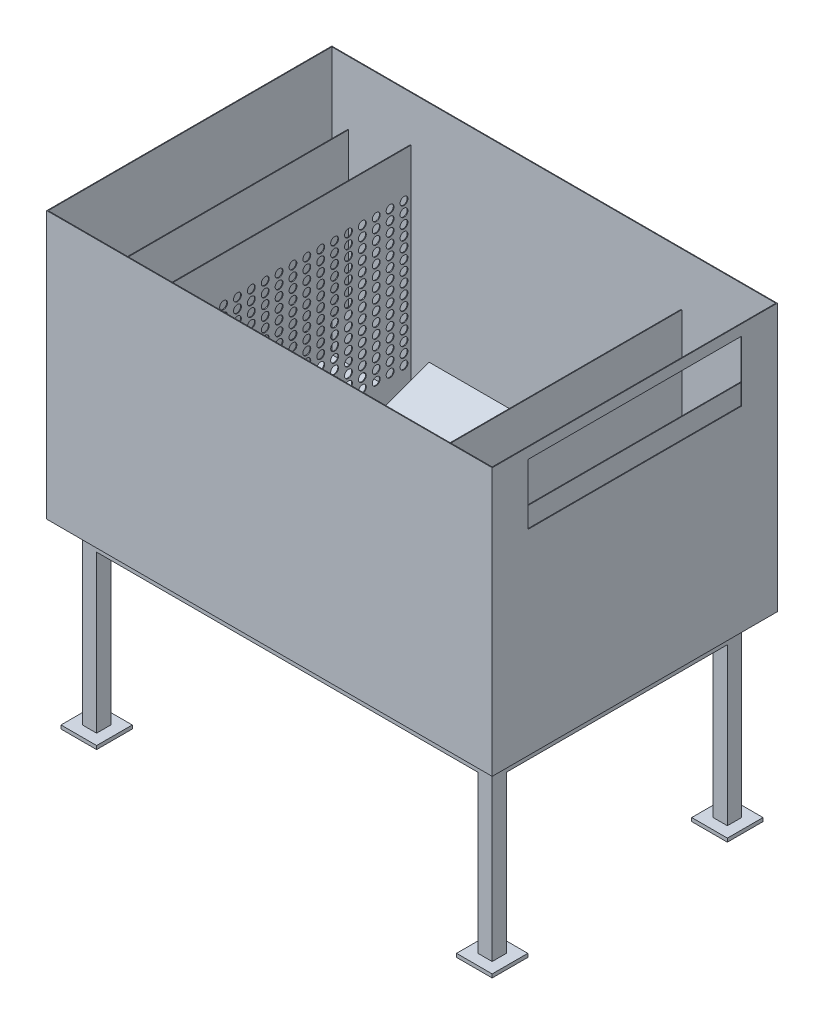
from build123d import *

# Parameters (mm, degrees)
MASTER_FOOTPRINT_W             = 1250
MASTER_FOOTPRINT_H             = 800
BATH_BASE_PLATE_DEPTH          = 750
BATH_SHELL_2MM_T               = -2
SKETCH_1_R                     = 50
INLET_D100_OPENING_DEPTH       = 10
INLET_IMPACT_BAFFLE_START      = 125
SKETCH_2_W                     = 640
SKETCH_2_H                     = 430
INLET_IMPACT_BAFFLE_DEPTH      = 2
DISTRIBUTOR_D22_START          = 250
SKETCH_3_W                     = 740
SKETCH_3_H                     = 648
SKETCH_3_R                     = 11
DISTRIBUTOR_D22_DEPTH          = 2
OUTLET_SUBMERGED_BAFFLE_START  = 1030
SKETCH_4_W                     = 700
SKETCH_4_H                     = 330
OUTLET_SUBMERGED_BAFFLE_DEPTH  = 2
OVERFLOW_WEIR_Z550_START       = 1190
SKETCH_5_W                     = 790
SKETCH_5_H                     = 548
OVERFLOW_WEIR_Z550_DEPTH       = 2
OUTLET_WEIR_SLOT_W600_START    = 1245
SKETCH_6_W                     = 600
SKETCH_6_H                     = 170
OUTLET_WEIR_SLOT_W600_DEPTH    = 10
SLOPED_SEDIMENT_FLOOR_START    = 275
SLOPED_SEDIMENT_FLOOR_DEPTH    = 725
SKETCH_8_W                     = 40
SKETCH_8_H                     = 40
FRAME_LEGS_40X40_H500_DEPTH    = 500
FRAME_LONGITUDINAL_RAILS_START = -20
SKETCH_9_W                     = 1150
SKETCH_9_H                     = 40
FRAME_LONGITUDINAL_RAILS_DEPTH = 40
FRAME_TRANSVERSE_RAILS_START   = -20
SKETCH_10_W                    = 40
SKETCH_10_H                    = 620
FRAME_TRANSVERSE_RAILS_DEPTH   = 40
FRAME_FOOT_PADS_100X100_START  = -500
SKETCH_11_W                    = 100
SKETCH_11_H                    = 100
FRAME_FOOT_PADS_100X100_DEPTH  = 10


with BuildPart() as part:
    # MASTER_FOOTPRINT → BATH_BASE_PLATE (new body)
    with BuildSketch(Plane(origin=(0, 0, 0), x_dir=(1, 0, 0), z_dir=(0, 1, 0))):
        with Locations((625, 400)):
            Rectangle(MASTER_FOOTPRINT_W, MASTER_FOOTPRINT_H)
    extrude(amount=BATH_BASE_PLATE_DEPTH)

    # BATH_SHELL_2MM
    bath_shell_2mm_openings = [part.faces().sort_by_distance(p)[0] for p in [
        (625, 750, -400),
    ]]
    offset(amount=BATH_SHELL_2MM_T, openings=bath_shell_2mm_openings, kind=Kind.INTERSECTION)

    # Эскиз1 → INLET_D100_OPENING (cut)
    with BuildSketch(Plane(origin=(0, 0, 0), x_dir=(0, 0, -1), z_dir=(1, 0, 0))):
        with Locations((400, 420)):
            Circle(SKETCH_1_R)
    extrude(amount=INLET_D100_OPENING_DEPTH, mode=Mode.SUBTRACT)

    # Эскиз6 → OUTLET_WEIR_SLOT_W600 (cut)
    with BuildSketch(Plane(origin=(0, 0, 0), x_dir=(0, 0, -1), z_dir=(1, 0, 0)).offset(OUTLET_WEIR_SLOT_W600_START)):
        with Locations((400, 635)):
            Rectangle(SKETCH_6_W, SKETCH_6_H)
    extrude(amount=OUTLET_WEIR_SLOT_W600_DEPTH, mode=Mode.SUBTRACT)

    # Эскиз7 → SLOPED_SEDIMENT_FLOOR (add)
    with BuildSketch(Plane(origin=(0, 0, 0), x_dir=(0, 0, -1), z_dir=(1, 0, 0)).offset(SLOPED_SEDIMENT_FLOOR_START)):
        Polygon((2, -1), (2, 120), (330, -1), align=None)
        Polygon((798, -1), (798, 120), (470, -1), align=None)
    extrude(amount=SLOPED_SEDIMENT_FLOOR_DEPTH)

    # Эскиз8 → FRAME_LEGS_40X40_H500 (add)
    with BuildSketch(Plane(origin=(0, 0, 0), x_dir=(1, 0, 0), z_dir=(0, 1, 0))):
        with Locations((70, 70)):
            Rectangle(SKETCH_8_W, SKETCH_8_H)
        with Locations((70, 730)):
            Rectangle(SKETCH_8_W, SKETCH_8_H)
        with Locations((1180, 70)):
            Rectangle(SKETCH_8_W, SKETCH_8_H)
        with Locations((1180, 730)):
            Rectangle(SKETCH_8_W, SKETCH_8_H)
    extrude(amount=-FRAME_LEGS_40X40_H500_DEPTH)

    # Эскиз9 → FRAME_LONGITUDINAL_RAILS (add)
    with BuildSketch(Plane(origin=(0, 0, 0), x_dir=(1, 0, 0), z_dir=(0, 1, 0)).offset(FRAME_LONGITUDINAL_RAILS_START)):
        with Locations((625, 70)):
            Rectangle(SKETCH_9_W, SKETCH_9_H)
        with Locations((625, 730)):
            Rectangle(SKETCH_9_W, SKETCH_9_H)
    extrude(amount=-FRAME_LONGITUDINAL_RAILS_DEPTH)

    # Эскиз10 → FRAME_TRANSVERSE_RAILS (add)
    with BuildSketch(Plane(origin=(0, 0, 0), x_dir=(1, 0, 0), z_dir=(0, 1, 0)).offset(FRAME_TRANSVERSE_RAILS_START)):
        with Locations((70, 400)):
            Rectangle(SKETCH_10_W, SKETCH_10_H)
        with Locations((1180, 400)):
            Rectangle(SKETCH_10_W, SKETCH_10_H)
    extrude(amount=-FRAME_TRANSVERSE_RAILS_DEPTH)

    # Эскиз11 → FRAME_FOOT_PADS_100X100 (add)
    with BuildSketch(Plane(origin=(0, 0, 0), x_dir=(1, 0, 0), z_dir=(0, 1, 0)).offset(FRAME_FOOT_PADS_100X100_START)):
        with Locations((70, 70)):
            Rectangle(SKETCH_11_W, SKETCH_11_H)
        with Locations((70, 730)):
            Rectangle(SKETCH_11_W, SKETCH_11_H)
        with Locations((1180, 70)):
            Rectangle(SKETCH_11_W, SKETCH_11_H)
        with Locations((1180, 730)):
            Rectangle(SKETCH_11_W, SKETCH_11_H)
    extrude(amount=-FRAME_FOOT_PADS_100X100_DEPTH)


with BuildPart() as body_2:
    # Эскиз2 → INLET_IMPACT_BAFFLE (new body)
    with BuildSketch(Plane(origin=(0, 0, 0), x_dir=(0, 0, -1), z_dir=(1, 0, 0)).offset(INLET_IMPACT_BAFFLE_START)):
        with Locations((400, 435)):
            Rectangle(SKETCH_2_W, SKETCH_2_H)
    extrude(amount=INLET_IMPACT_BAFFLE_DEPTH)


with BuildPart() as body_3:
    # Эскиз3 → DISTRIBUTOR_D22 (new body)
    with BuildSketch(Plane(origin=(0, 0, 0), x_dir=(0, 0, -1), z_dir=(1, 0, 0)).offset(DISTRIBUTOR_D22_START)):
        with Locations((400, 326)):
            Rectangle(SKETCH_3_W, SKETCH_3_H)
        with Locations((49.473684211, 125)):
            Circle(SKETCH_3_R, mode=Mode.SUBTRACT)
        with Locations((49.473684211, 153.5)):
            Circle(SKETCH_3_R, mode=Mode.SUBTRACT)
        with Locations((49.473684211, 182)):
            Circle(SKETCH_3_R, mode=Mode.SUBTRACT)
        with Locations((49.473684211, 210.5)):
            Circle(SKETCH_3_R, mode=Mode.SUBTRACT)
        with Locations((49.473684211, 239)):
            Circle(SKETCH_3_R, mode=Mode.SUBTRACT)
        with Locations((49.473684211, 267.5)):
            Circle(SKETCH_3_R, mode=Mode.SUBTRACT)
        with Locations((49.473684211, 296)):
            Circle(SKETCH_3_R, mode=Mode.SUBTRACT)
        with Locations((49.473684211, 324.5)):
            Circle(SKETCH_3_R, mode=Mode.SUBTRACT)
        with Locations((49.473684211, 353)):
            Circle(SKETCH_3_R, mode=Mode.SUBTRACT)
        with Locations((49.473684211, 381.5)):
            Circle(SKETCH_3_R, mode=Mode.SUBTRACT)
        with Locations((49.473684211, 410)):
            Circle(SKETCH_3_R, mode=Mode.SUBTRACT)
        with Locations((49.473684211, 438.5)):
            Circle(SKETCH_3_R, mode=Mode.SUBTRACT)
        with Locations((49.473684211, 467)):
            Circle(SKETCH_3_R, mode=Mode.SUBTRACT)
        with Locations((49.473684211, 495.5)):
            Circle(SKETCH_3_R, mode=Mode.SUBTRACT)
        with Locations((49.473684211, 524)):
            Circle(SKETCH_3_R, mode=Mode.SUBTRACT)
        with Locations((88.421052632, 125)):
            Circle(SKETCH_3_R, mode=Mode.SUBTRACT)
        with Locations((88.421052632, 153.5)):
            Circle(SKETCH_3_R, mode=Mode.SUBTRACT)
        with Locations((88.421052632, 182)):
            Circle(SKETCH_3_R, mode=Mode.SUBTRACT)
        with Locations((88.421052632, 210.5)):
            Circle(SKETCH_3_R, mode=Mode.SUBTRACT)
        with Locations((88.421052632, 239)):
            Circle(SKETCH_3_R, mode=Mode.SUBTRACT)
        with Locations((88.421052632, 267.5)):
            Circle(SKETCH_3_R, mode=Mode.SUBTRACT)
        with Locations((88.421052632, 296)):
            Circle(SKETCH_3_R, mode=Mode.SUBTRACT)
        with Locations((88.421052632, 324.5)):
            Circle(SKETCH_3_R, mode=Mode.SUBTRACT)
        with Locations((88.421052632, 353)):
            Circle(SKETCH_3_R, mode=Mode.SUBTRACT)
        with Locations((88.421052632, 381.5)):
            Circle(SKETCH_3_R, mode=Mode.SUBTRACT)
        with Locations((88.421052632, 410)):
            Circle(SKETCH_3_R, mode=Mode.SUBTRACT)
        with Locations((88.421052632, 438.5)):
            Circle(SKETCH_3_R, mode=Mode.SUBTRACT)
        with Locations((88.421052632, 467)):
            Circle(SKETCH_3_R, mode=Mode.SUBTRACT)
        with Locations((88.421052632, 495.5)):
            Circle(SKETCH_3_R, mode=Mode.SUBTRACT)
        with Locations((88.421052632, 524)):
            Circle(SKETCH_3_R, mode=Mode.SUBTRACT)
        with Locations((127.368421053, 125)):
            Circle(SKETCH_3_R, mode=Mode.SUBTRACT)
        with Locations((127.368421053, 153.5)):
            Circle(SKETCH_3_R, mode=Mode.SUBTRACT)
        with Locations((127.368421053, 182)):
            Circle(SKETCH_3_R, mode=Mode.SUBTRACT)
        with Locations((127.368421053, 210.5)):
            Circle(SKETCH_3_R, mode=Mode.SUBTRACT)
        with Locations((127.368421053, 239)):
            Circle(SKETCH_3_R, mode=Mode.SUBTRACT)
        with Locations((127.368421053, 267.5)):
            Circle(SKETCH_3_R, mode=Mode.SUBTRACT)
        with Locations((127.368421053, 296)):
            Circle(SKETCH_3_R, mode=Mode.SUBTRACT)
        with Locations((127.368421053, 324.5)):
            Circle(SKETCH_3_R, mode=Mode.SUBTRACT)
        with Locations((127.368421053, 353)):
            Circle(SKETCH_3_R, mode=Mode.SUBTRACT)
        with Locations((127.368421053, 381.5)):
            Circle(SKETCH_3_R, mode=Mode.SUBTRACT)
        with Locations((127.368421053, 410)):
            Circle(SKETCH_3_R, mode=Mode.SUBTRACT)
        with Locations((127.368421053, 438.5)):
            Circle(SKETCH_3_R, mode=Mode.SUBTRACT)
        with Locations((127.368421053, 467)):
            Circle(SKETCH_3_R, mode=Mode.SUBTRACT)
        with Locations((127.368421053, 495.5)):
            Circle(SKETCH_3_R, mode=Mode.SUBTRACT)
        with Locations((127.368421053, 524)):
            Circle(SKETCH_3_R, mode=Mode.SUBTRACT)
        with Locations((166.315789474, 125)):
            Circle(SKETCH_3_R, mode=Mode.SUBTRACT)
        with Locations((166.315789474, 153.5)):
            Circle(SKETCH_3_R, mode=Mode.SUBTRACT)
        with Locations((166.315789474, 182)):
            Circle(SKETCH_3_R, mode=Mode.SUBTRACT)
        with Locations((166.315789474, 210.5)):
            Circle(SKETCH_3_R, mode=Mode.SUBTRACT)
        with Locations((166.315789474, 239)):
            Circle(SKETCH_3_R, mode=Mode.SUBTRACT)
        with Locations((166.315789474, 267.5)):
            Circle(SKETCH_3_R, mode=Mode.SUBTRACT)
        with Locations((166.315789474, 296)):
            Circle(SKETCH_3_R, mode=Mode.SUBTRACT)
        with Locations((166.315789474, 324.5)):
            Circle(SKETCH_3_R, mode=Mode.SUBTRACT)
        with Locations((166.315789474, 353)):
            Circle(SKETCH_3_R, mode=Mode.SUBTRACT)
        with Locations((166.315789474, 381.5)):
            Circle(SKETCH_3_R, mode=Mode.SUBTRACT)
        with Locations((166.315789474, 410)):
            Circle(SKETCH_3_R, mode=Mode.SUBTRACT)
        with Locations((166.315789474, 438.5)):
            Circle(SKETCH_3_R, mode=Mode.SUBTRACT)
        with Locations((166.315789474, 467)):
            Circle(SKETCH_3_R, mode=Mode.SUBTRACT)
        with Locations((166.315789474, 495.5)):
            Circle(SKETCH_3_R, mode=Mode.SUBTRACT)
        with Locations((166.315789474, 524)):
            Circle(SKETCH_3_R, mode=Mode.SUBTRACT)
        with Locations((205.263157895, 125)):
            Circle(SKETCH_3_R, mode=Mode.SUBTRACT)
        with Locations((205.263157895, 153.5)):
            Circle(SKETCH_3_R, mode=Mode.SUBTRACT)
        with Locations((205.263157895, 182)):
            Circle(SKETCH_3_R, mode=Mode.SUBTRACT)
        with Locations((205.263157895, 210.5)):
            Circle(SKETCH_3_R, mode=Mode.SUBTRACT)
        with Locations((205.263157895, 239)):
            Circle(SKETCH_3_R, mode=Mode.SUBTRACT)
        with Locations((205.263157895, 267.5)):
            Circle(SKETCH_3_R, mode=Mode.SUBTRACT)
        with Locations((205.263157895, 296)):
            Circle(SKETCH_3_R, mode=Mode.SUBTRACT)
        with Locations((205.263157895, 324.5)):
            Circle(SKETCH_3_R, mode=Mode.SUBTRACT)
        with Locations((205.263157895, 353)):
            Circle(SKETCH_3_R, mode=Mode.SUBTRACT)
        with Locations((205.263157895, 381.5)):
            Circle(SKETCH_3_R, mode=Mode.SUBTRACT)
        with Locations((205.263157895, 410)):
            Circle(SKETCH_3_R, mode=Mode.SUBTRACT)
        with Locations((205.263157895, 438.5)):
            Circle(SKETCH_3_R, mode=Mode.SUBTRACT)
        with Locations((205.263157895, 467)):
            Circle(SKETCH_3_R, mode=Mode.SUBTRACT)
        with Locations((205.263157895, 495.5)):
            Circle(SKETCH_3_R, mode=Mode.SUBTRACT)
        with Locations((205.263157895, 524)):
            Circle(SKETCH_3_R, mode=Mode.SUBTRACT)
        with Locations((244.210526316, 125)):
            Circle(SKETCH_3_R, mode=Mode.SUBTRACT)
        with Locations((244.210526316, 153.5)):
            Circle(SKETCH_3_R, mode=Mode.SUBTRACT)
        with Locations((244.210526316, 182)):
            Circle(SKETCH_3_R, mode=Mode.SUBTRACT)
        with Locations((244.210526316, 210.5)):
            Circle(SKETCH_3_R, mode=Mode.SUBTRACT)
        with Locations((244.210526316, 239)):
            Circle(SKETCH_3_R, mode=Mode.SUBTRACT)
        with Locations((244.210526316, 267.5)):
            Circle(SKETCH_3_R, mode=Mode.SUBTRACT)
        with Locations((244.210526316, 296)):
            Circle(SKETCH_3_R, mode=Mode.SUBTRACT)
        with Locations((244.210526316, 324.5)):
            Circle(SKETCH_3_R, mode=Mode.SUBTRACT)
        with Locations((244.210526316, 353)):
            Circle(SKETCH_3_R, mode=Mode.SUBTRACT)
        with Locations((244.210526316, 381.5)):
            Circle(SKETCH_3_R, mode=Mode.SUBTRACT)
        with Locations((244.210526316, 410)):
            Circle(SKETCH_3_R, mode=Mode.SUBTRACT)
        with Locations((244.210526316, 438.5)):
            Circle(SKETCH_3_R, mode=Mode.SUBTRACT)
        with Locations((244.210526316, 467)):
            Circle(SKETCH_3_R, mode=Mode.SUBTRACT)
        with Locations((244.210526316, 495.5)):
            Circle(SKETCH_3_R, mode=Mode.SUBTRACT)
        with Locations((244.210526316, 524)):
            Circle(SKETCH_3_R, mode=Mode.SUBTRACT)
        with Locations((283.157894737, 125)):
            Circle(SKETCH_3_R, mode=Mode.SUBTRACT)
        with Locations((283.157894737, 153.5)):
            Circle(SKETCH_3_R, mode=Mode.SUBTRACT)
        with Locations((283.157894737, 182)):
            Circle(SKETCH_3_R, mode=Mode.SUBTRACT)
        with Locations((283.157894737, 210.5)):
            Circle(SKETCH_3_R, mode=Mode.SUBTRACT)
        with Locations((283.157894737, 239)):
            Circle(SKETCH_3_R, mode=Mode.SUBTRACT)
        with Locations((283.157894737, 267.5)):
            Circle(SKETCH_3_R, mode=Mode.SUBTRACT)
        with Locations((283.157894737, 296)):
            Circle(SKETCH_3_R, mode=Mode.SUBTRACT)
        with Locations((283.157894737, 324.5)):
            Circle(SKETCH_3_R, mode=Mode.SUBTRACT)
        with Locations((283.157894737, 353)):
            Circle(SKETCH_3_R, mode=Mode.SUBTRACT)
        with Locations((283.157894737, 381.5)):
            Circle(SKETCH_3_R, mode=Mode.SUBTRACT)
        with Locations((283.157894737, 410)):
            Circle(SKETCH_3_R, mode=Mode.SUBTRACT)
        with Locations((283.157894737, 438.5)):
            Circle(SKETCH_3_R, mode=Mode.SUBTRACT)
        with Locations((283.157894737, 467)):
            Circle(SKETCH_3_R, mode=Mode.SUBTRACT)
        with Locations((283.157894737, 495.5)):
            Circle(SKETCH_3_R, mode=Mode.SUBTRACT)
        with Locations((283.157894737, 524)):
            Circle(SKETCH_3_R, mode=Mode.SUBTRACT)
        with Locations((322.105263158, 125)):
            Circle(SKETCH_3_R, mode=Mode.SUBTRACT)
        with Locations((322.105263158, 153.5)):
            Circle(SKETCH_3_R, mode=Mode.SUBTRACT)
        with Locations((322.105263158, 182)):
            Circle(SKETCH_3_R, mode=Mode.SUBTRACT)
        with Locations((322.105263158, 210.5)):
            Circle(SKETCH_3_R, mode=Mode.SUBTRACT)
        with Locations((322.105263158, 239)):
            Circle(SKETCH_3_R, mode=Mode.SUBTRACT)
        with Locations((322.105263158, 267.5)):
            Circle(SKETCH_3_R, mode=Mode.SUBTRACT)
        with Locations((322.105263158, 296)):
            Circle(SKETCH_3_R, mode=Mode.SUBTRACT)
        with Locations((322.105263158, 324.5)):
            Circle(SKETCH_3_R, mode=Mode.SUBTRACT)
        with Locations((322.105263158, 353)):
            Circle(SKETCH_3_R, mode=Mode.SUBTRACT)
        with Locations((322.105263158, 381.5)):
            Circle(SKETCH_3_R, mode=Mode.SUBTRACT)
        with Locations((322.105263158, 410)):
            Circle(SKETCH_3_R, mode=Mode.SUBTRACT)
        with Locations((322.105263158, 438.5)):
            Circle(SKETCH_3_R, mode=Mode.SUBTRACT)
        with Locations((322.105263158, 467)):
            Circle(SKETCH_3_R, mode=Mode.SUBTRACT)
        with Locations((322.105263158, 495.5)):
            Circle(SKETCH_3_R, mode=Mode.SUBTRACT)
        with Locations((322.105263158, 524)):
            Circle(SKETCH_3_R, mode=Mode.SUBTRACT)
        with Locations((361.052631579, 125)):
            Circle(SKETCH_3_R, mode=Mode.SUBTRACT)
        with Locations((361.052631579, 153.5)):
            Circle(SKETCH_3_R, mode=Mode.SUBTRACT)
        with Locations((361.052631579, 182)):
            Circle(SKETCH_3_R, mode=Mode.SUBTRACT)
        with Locations((361.052631579, 210.5)):
            Circle(SKETCH_3_R, mode=Mode.SUBTRACT)
        with Locations((361.052631579, 239)):
            Circle(SKETCH_3_R, mode=Mode.SUBTRACT)
        with Locations((361.052631579, 267.5)):
            Circle(SKETCH_3_R, mode=Mode.SUBTRACT)
        with Locations((361.052631579, 296)):
            Circle(SKETCH_3_R, mode=Mode.SUBTRACT)
        with Locations((361.052631579, 324.5)):
            Circle(SKETCH_3_R, mode=Mode.SUBTRACT)
        with Locations((361.052631579, 353)):
            Circle(SKETCH_3_R, mode=Mode.SUBTRACT)
        with Locations((361.052631579, 381.5)):
            Circle(SKETCH_3_R, mode=Mode.SUBTRACT)
        with Locations((361.052631579, 410)):
            Circle(SKETCH_3_R, mode=Mode.SUBTRACT)
        with Locations((361.052631579, 438.5)):
            Circle(SKETCH_3_R, mode=Mode.SUBTRACT)
        with Locations((361.052631579, 467)):
            Circle(SKETCH_3_R, mode=Mode.SUBTRACT)
        with Locations((361.052631579, 495.5)):
            Circle(SKETCH_3_R, mode=Mode.SUBTRACT)
        with Locations((361.052631579, 524)):
            Circle(SKETCH_3_R, mode=Mode.SUBTRACT)
        with Locations((400, 125)):
            Circle(SKETCH_3_R, mode=Mode.SUBTRACT)
        with Locations((400, 153.5)):
            Circle(SKETCH_3_R, mode=Mode.SUBTRACT)
        with Locations((400, 182)):
            Circle(SKETCH_3_R, mode=Mode.SUBTRACT)
        with Locations((400, 210.5)):
            Circle(SKETCH_3_R, mode=Mode.SUBTRACT)
        with Locations((400, 239)):
            Circle(SKETCH_3_R, mode=Mode.SUBTRACT)
        with Locations((400, 267.5)):
            Circle(SKETCH_3_R, mode=Mode.SUBTRACT)
        with Locations((400, 296)):
            Circle(SKETCH_3_R, mode=Mode.SUBTRACT)
        with Locations((400, 324.5)):
            Circle(SKETCH_3_R, mode=Mode.SUBTRACT)
        with Locations((400, 353)):
            Circle(SKETCH_3_R, mode=Mode.SUBTRACT)
        with Locations((400, 381.5)):
            Circle(SKETCH_3_R, mode=Mode.SUBTRACT)
        with Locations((400, 410)):
            Circle(SKETCH_3_R, mode=Mode.SUBTRACT)
        with Locations((400, 438.5)):
            Circle(SKETCH_3_R, mode=Mode.SUBTRACT)
        with Locations((400, 467)):
            Circle(SKETCH_3_R, mode=Mode.SUBTRACT)
        with Locations((400, 495.5)):
            Circle(SKETCH_3_R, mode=Mode.SUBTRACT)
        with Locations((400, 524)):
            Circle(SKETCH_3_R, mode=Mode.SUBTRACT)
        with Locations((438.947368421, 125)):
            Circle(SKETCH_3_R, mode=Mode.SUBTRACT)
        with Locations((438.947368421, 153.5)):
            Circle(SKETCH_3_R, mode=Mode.SUBTRACT)
        with Locations((438.947368421, 182)):
            Circle(SKETCH_3_R, mode=Mode.SUBTRACT)
        with Locations((438.947368421, 210.5)):
            Circle(SKETCH_3_R, mode=Mode.SUBTRACT)
        with Locations((438.947368421, 239)):
            Circle(SKETCH_3_R, mode=Mode.SUBTRACT)
        with Locations((438.947368421, 267.5)):
            Circle(SKETCH_3_R, mode=Mode.SUBTRACT)
        with Locations((438.947368421, 296)):
            Circle(SKETCH_3_R, mode=Mode.SUBTRACT)
        with Locations((438.947368421, 324.5)):
            Circle(SKETCH_3_R, mode=Mode.SUBTRACT)
        with Locations((438.947368421, 353)):
            Circle(SKETCH_3_R, mode=Mode.SUBTRACT)
        with Locations((438.947368421, 381.5)):
            Circle(SKETCH_3_R, mode=Mode.SUBTRACT)
        with Locations((438.947368421, 410)):
            Circle(SKETCH_3_R, mode=Mode.SUBTRACT)
        with Locations((438.947368421, 438.5)):
            Circle(SKETCH_3_R, mode=Mode.SUBTRACT)
        with Locations((438.947368421, 467)):
            Circle(SKETCH_3_R, mode=Mode.SUBTRACT)
        with Locations((438.947368421, 495.5)):
            Circle(SKETCH_3_R, mode=Mode.SUBTRACT)
        with Locations((438.947368421, 524)):
            Circle(SKETCH_3_R, mode=Mode.SUBTRACT)
        with Locations((477.894736842, 125)):
            Circle(SKETCH_3_R, mode=Mode.SUBTRACT)
        with Locations((477.894736842, 153.5)):
            Circle(SKETCH_3_R, mode=Mode.SUBTRACT)
        with Locations((477.894736842, 182)):
            Circle(SKETCH_3_R, mode=Mode.SUBTRACT)
        with Locations((477.894736842, 210.5)):
            Circle(SKETCH_3_R, mode=Mode.SUBTRACT)
        with Locations((477.894736842, 239)):
            Circle(SKETCH_3_R, mode=Mode.SUBTRACT)
        with Locations((477.894736842, 267.5)):
            Circle(SKETCH_3_R, mode=Mode.SUBTRACT)
        with Locations((477.894736842, 296)):
            Circle(SKETCH_3_R, mode=Mode.SUBTRACT)
        with Locations((477.894736842, 324.5)):
            Circle(SKETCH_3_R, mode=Mode.SUBTRACT)
        with Locations((477.894736842, 353)):
            Circle(SKETCH_3_R, mode=Mode.SUBTRACT)
        with Locations((477.894736842, 381.5)):
            Circle(SKETCH_3_R, mode=Mode.SUBTRACT)
        with Locations((477.894736842, 410)):
            Circle(SKETCH_3_R, mode=Mode.SUBTRACT)
        with Locations((477.894736842, 438.5)):
            Circle(SKETCH_3_R, mode=Mode.SUBTRACT)
        with Locations((477.894736842, 467)):
            Circle(SKETCH_3_R, mode=Mode.SUBTRACT)
        with Locations((477.894736842, 495.5)):
            Circle(SKETCH_3_R, mode=Mode.SUBTRACT)
        with Locations((477.894736842, 524)):
            Circle(SKETCH_3_R, mode=Mode.SUBTRACT)
        with Locations((516.842105263, 125)):
            Circle(SKETCH_3_R, mode=Mode.SUBTRACT)
        with Locations((516.842105263, 153.5)):
            Circle(SKETCH_3_R, mode=Mode.SUBTRACT)
        with Locations((516.842105263, 182)):
            Circle(SKETCH_3_R, mode=Mode.SUBTRACT)
        with Locations((516.842105263, 210.5)):
            Circle(SKETCH_3_R, mode=Mode.SUBTRACT)
        with Locations((516.842105263, 239)):
            Circle(SKETCH_3_R, mode=Mode.SUBTRACT)
        with Locations((516.842105263, 267.5)):
            Circle(SKETCH_3_R, mode=Mode.SUBTRACT)
        with Locations((516.842105263, 296)):
            Circle(SKETCH_3_R, mode=Mode.SUBTRACT)
        with Locations((516.842105263, 324.5)):
            Circle(SKETCH_3_R, mode=Mode.SUBTRACT)
        with Locations((516.842105263, 353)):
            Circle(SKETCH_3_R, mode=Mode.SUBTRACT)
        with Locations((516.842105263, 381.5)):
            Circle(SKETCH_3_R, mode=Mode.SUBTRACT)
        with Locations((516.842105263, 410)):
            Circle(SKETCH_3_R, mode=Mode.SUBTRACT)
        with Locations((516.842105263, 438.5)):
            Circle(SKETCH_3_R, mode=Mode.SUBTRACT)
        with Locations((516.842105263, 467)):
            Circle(SKETCH_3_R, mode=Mode.SUBTRACT)
        with Locations((516.842105263, 495.5)):
            Circle(SKETCH_3_R, mode=Mode.SUBTRACT)
        with Locations((516.842105263, 524)):
            Circle(SKETCH_3_R, mode=Mode.SUBTRACT)
        with Locations((555.789473684, 125)):
            Circle(SKETCH_3_R, mode=Mode.SUBTRACT)
        with Locations((555.789473684, 153.5)):
            Circle(SKETCH_3_R, mode=Mode.SUBTRACT)
        with Locations((555.789473684, 182)):
            Circle(SKETCH_3_R, mode=Mode.SUBTRACT)
        with Locations((555.789473684, 210.5)):
            Circle(SKETCH_3_R, mode=Mode.SUBTRACT)
        with Locations((555.789473684, 239)):
            Circle(SKETCH_3_R, mode=Mode.SUBTRACT)
        with Locations((555.789473684, 267.5)):
            Circle(SKETCH_3_R, mode=Mode.SUBTRACT)
        with Locations((555.789473684, 296)):
            Circle(SKETCH_3_R, mode=Mode.SUBTRACT)
        with Locations((555.789473684, 324.5)):
            Circle(SKETCH_3_R, mode=Mode.SUBTRACT)
        with Locations((555.789473684, 353)):
            Circle(SKETCH_3_R, mode=Mode.SUBTRACT)
        with Locations((555.789473684, 381.5)):
            Circle(SKETCH_3_R, mode=Mode.SUBTRACT)
        with Locations((555.789473684, 410)):
            Circle(SKETCH_3_R, mode=Mode.SUBTRACT)
        with Locations((555.789473684, 438.5)):
            Circle(SKETCH_3_R, mode=Mode.SUBTRACT)
        with Locations((555.789473684, 467)):
            Circle(SKETCH_3_R, mode=Mode.SUBTRACT)
        with Locations((555.789473684, 495.5)):
            Circle(SKETCH_3_R, mode=Mode.SUBTRACT)
        with Locations((555.789473684, 524)):
            Circle(SKETCH_3_R, mode=Mode.SUBTRACT)
        with Locations((594.736842105, 125)):
            Circle(SKETCH_3_R, mode=Mode.SUBTRACT)
        with Locations((594.736842105, 153.5)):
            Circle(SKETCH_3_R, mode=Mode.SUBTRACT)
        with Locations((594.736842105, 182)):
            Circle(SKETCH_3_R, mode=Mode.SUBTRACT)
        with Locations((594.736842105, 210.5)):
            Circle(SKETCH_3_R, mode=Mode.SUBTRACT)
        with Locations((594.736842105, 239)):
            Circle(SKETCH_3_R, mode=Mode.SUBTRACT)
        with Locations((594.736842105, 267.5)):
            Circle(SKETCH_3_R, mode=Mode.SUBTRACT)
        with Locations((594.736842105, 296)):
            Circle(SKETCH_3_R, mode=Mode.SUBTRACT)
        with Locations((594.736842105, 324.5)):
            Circle(SKETCH_3_R, mode=Mode.SUBTRACT)
        with Locations((594.736842105, 353)):
            Circle(SKETCH_3_R, mode=Mode.SUBTRACT)
        with Locations((594.736842105, 381.5)):
            Circle(SKETCH_3_R, mode=Mode.SUBTRACT)
        with Locations((594.736842105, 410)):
            Circle(SKETCH_3_R, mode=Mode.SUBTRACT)
        with Locations((594.736842105, 438.5)):
            Circle(SKETCH_3_R, mode=Mode.SUBTRACT)
        with Locations((594.736842105, 467)):
            Circle(SKETCH_3_R, mode=Mode.SUBTRACT)
        with Locations((594.736842105, 495.5)):
            Circle(SKETCH_3_R, mode=Mode.SUBTRACT)
        with Locations((594.736842105, 524)):
            Circle(SKETCH_3_R, mode=Mode.SUBTRACT)
        with Locations((633.684210526, 125)):
            Circle(SKETCH_3_R, mode=Mode.SUBTRACT)
        with Locations((633.684210526, 153.5)):
            Circle(SKETCH_3_R, mode=Mode.SUBTRACT)
        with Locations((633.684210526, 182)):
            Circle(SKETCH_3_R, mode=Mode.SUBTRACT)
        with Locations((633.684210526, 210.5)):
            Circle(SKETCH_3_R, mode=Mode.SUBTRACT)
        with Locations((633.684210526, 239)):
            Circle(SKETCH_3_R, mode=Mode.SUBTRACT)
        with Locations((633.684210526, 267.5)):
            Circle(SKETCH_3_R, mode=Mode.SUBTRACT)
        with Locations((633.684210526, 296)):
            Circle(SKETCH_3_R, mode=Mode.SUBTRACT)
        with Locations((633.684210526, 324.5)):
            Circle(SKETCH_3_R, mode=Mode.SUBTRACT)
        with Locations((633.684210526, 353)):
            Circle(SKETCH_3_R, mode=Mode.SUBTRACT)
        with Locations((633.684210526, 381.5)):
            Circle(SKETCH_3_R, mode=Mode.SUBTRACT)
        with Locations((633.684210526, 410)):
            Circle(SKETCH_3_R, mode=Mode.SUBTRACT)
        with Locations((633.684210526, 438.5)):
            Circle(SKETCH_3_R, mode=Mode.SUBTRACT)
        with Locations((633.684210526, 467)):
            Circle(SKETCH_3_R, mode=Mode.SUBTRACT)
        with Locations((633.684210526, 495.5)):
            Circle(SKETCH_3_R, mode=Mode.SUBTRACT)
        with Locations((633.684210526, 524)):
            Circle(SKETCH_3_R, mode=Mode.SUBTRACT)
        with Locations((672.631578947, 125)):
            Circle(SKETCH_3_R, mode=Mode.SUBTRACT)
        with Locations((672.631578947, 153.5)):
            Circle(SKETCH_3_R, mode=Mode.SUBTRACT)
        with Locations((672.631578947, 182)):
            Circle(SKETCH_3_R, mode=Mode.SUBTRACT)
        with Locations((672.631578947, 210.5)):
            Circle(SKETCH_3_R, mode=Mode.SUBTRACT)
        with Locations((672.631578947, 239)):
            Circle(SKETCH_3_R, mode=Mode.SUBTRACT)
        with Locations((672.631578947, 267.5)):
            Circle(SKETCH_3_R, mode=Mode.SUBTRACT)
        with Locations((672.631578947, 296)):
            Circle(SKETCH_3_R, mode=Mode.SUBTRACT)
        with Locations((672.631578947, 324.5)):
            Circle(SKETCH_3_R, mode=Mode.SUBTRACT)
        with Locations((672.631578947, 353)):
            Circle(SKETCH_3_R, mode=Mode.SUBTRACT)
        with Locations((672.631578947, 381.5)):
            Circle(SKETCH_3_R, mode=Mode.SUBTRACT)
        with Locations((672.631578947, 410)):
            Circle(SKETCH_3_R, mode=Mode.SUBTRACT)
        with Locations((672.631578947, 438.5)):
            Circle(SKETCH_3_R, mode=Mode.SUBTRACT)
        with Locations((672.631578947, 467)):
            Circle(SKETCH_3_R, mode=Mode.SUBTRACT)
        with Locations((672.631578947, 495.5)):
            Circle(SKETCH_3_R, mode=Mode.SUBTRACT)
        with Locations((672.631578947, 524)):
            Circle(SKETCH_3_R, mode=Mode.SUBTRACT)
        with Locations((711.578947368, 125)):
            Circle(SKETCH_3_R, mode=Mode.SUBTRACT)
        with Locations((711.578947368, 153.5)):
            Circle(SKETCH_3_R, mode=Mode.SUBTRACT)
        with Locations((711.578947368, 182)):
            Circle(SKETCH_3_R, mode=Mode.SUBTRACT)
        with Locations((711.578947368, 210.5)):
            Circle(SKETCH_3_R, mode=Mode.SUBTRACT)
        with Locations((711.578947368, 239)):
            Circle(SKETCH_3_R, mode=Mode.SUBTRACT)
        with Locations((711.578947368, 267.5)):
            Circle(SKETCH_3_R, mode=Mode.SUBTRACT)
        with Locations((711.578947368, 296)):
            Circle(SKETCH_3_R, mode=Mode.SUBTRACT)
        with Locations((711.578947368, 324.5)):
            Circle(SKETCH_3_R, mode=Mode.SUBTRACT)
        with Locations((711.578947368, 353)):
            Circle(SKETCH_3_R, mode=Mode.SUBTRACT)
        with Locations((711.578947368, 381.5)):
            Circle(SKETCH_3_R, mode=Mode.SUBTRACT)
        with Locations((711.578947368, 410)):
            Circle(SKETCH_3_R, mode=Mode.SUBTRACT)
        with Locations((711.578947368, 438.5)):
            Circle(SKETCH_3_R, mode=Mode.SUBTRACT)
        with Locations((711.578947368, 467)):
            Circle(SKETCH_3_R, mode=Mode.SUBTRACT)
        with Locations((711.578947368, 495.5)):
            Circle(SKETCH_3_R, mode=Mode.SUBTRACT)
        with Locations((711.578947368, 524)):
            Circle(SKETCH_3_R, mode=Mode.SUBTRACT)
        with Locations((750.526315789, 125)):
            Circle(SKETCH_3_R, mode=Mode.SUBTRACT)
        with Locations((750.526315789, 153.5)):
            Circle(SKETCH_3_R, mode=Mode.SUBTRACT)
        with Locations((750.526315789, 182)):
            Circle(SKETCH_3_R, mode=Mode.SUBTRACT)
        with Locations((750.526315789, 210.5)):
            Circle(SKETCH_3_R, mode=Mode.SUBTRACT)
        with Locations((750.526315789, 239)):
            Circle(SKETCH_3_R, mode=Mode.SUBTRACT)
        with Locations((750.526315789, 267.5)):
            Circle(SKETCH_3_R, mode=Mode.SUBTRACT)
        with Locations((750.526315789, 296)):
            Circle(SKETCH_3_R, mode=Mode.SUBTRACT)
        with Locations((750.526315789, 324.5)):
            Circle(SKETCH_3_R, mode=Mode.SUBTRACT)
        with Locations((750.526315789, 353)):
            Circle(SKETCH_3_R, mode=Mode.SUBTRACT)
        with Locations((750.526315789, 381.5)):
            Circle(SKETCH_3_R, mode=Mode.SUBTRACT)
        with Locations((750.526315789, 410)):
            Circle(SKETCH_3_R, mode=Mode.SUBTRACT)
        with Locations((750.526315789, 438.5)):
            Circle(SKETCH_3_R, mode=Mode.SUBTRACT)
        with Locations((750.526315789, 467)):
            Circle(SKETCH_3_R, mode=Mode.SUBTRACT)
        with Locations((750.526315789, 495.5)):
            Circle(SKETCH_3_R, mode=Mode.SUBTRACT)
        with Locations((750.526315789, 524)):
            Circle(SKETCH_3_R, mode=Mode.SUBTRACT)
    extrude(amount=DISTRIBUTOR_D22_DEPTH)


with BuildPart() as body_4:
    # Эскиз4 → OUTLET_SUBMERGED_BAFFLE (new body)
    with BuildSketch(Plane(origin=(0, 0, 0), x_dir=(0, 0, -1), z_dir=(1, 0, 0)).offset(OUTLET_SUBMERGED_BAFFLE_START)):
        with Locations((400, 485)):
            Rectangle(SKETCH_4_W, SKETCH_4_H)
    extrude(amount=OUTLET_SUBMERGED_BAFFLE_DEPTH)


with BuildPart() as body_5:
    # Эскиз5 → OVERFLOW_WEIR_Z550 (new body)
    with BuildSketch(Plane(origin=(0, 0, 0), x_dir=(0, 0, -1), z_dir=(1, 0, 0)).offset(OVERFLOW_WEIR_Z550_START)):
        with Locations((400, 276)):
            Rectangle(SKETCH_5_W, SKETCH_5_H)
    extrude(amount=OVERFLOW_WEIR_Z550_DEPTH)


solid = Compound([part.part, body_2.part, body_3.part, body_4.part, body_5.part])
